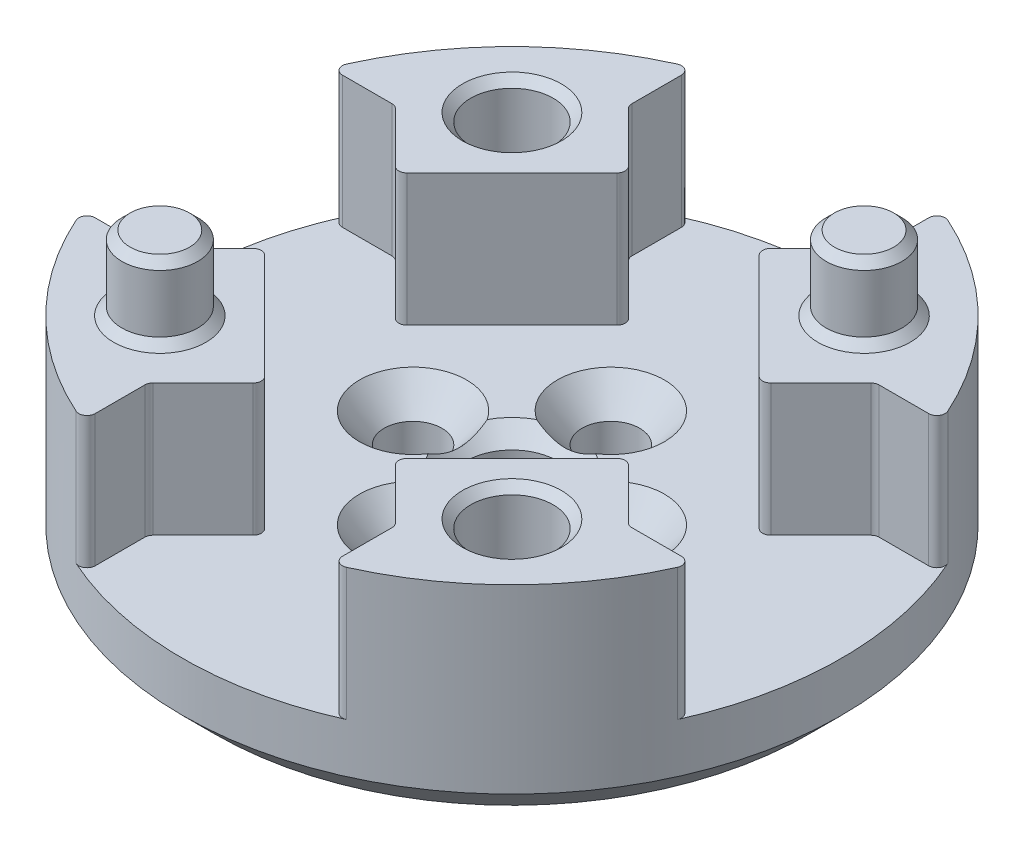
from build123d import *
from OCP.BRepFilletAPI import BRepFilletAPI_MakeChamfer

# Parameters (mm, degrees)
SKETCH_1_R                             = 20
EXTRUDE_1_DEPTH                        = 5
EXTRUDE_2_DEPTH                        = 8
FILLET_1_R                             = 0.5
PATTERN_START                          = 5
PATTERN_CIRCULAR_1_DEPTH               = 8
SKETCH_3_R                             = 2.5000000000000004
CUT_EXTRUDE_1_DEPTH                    = 5
EXTRUDE_START                          = 4.5
SKETCH_3_3_R                           = 2.5000000000000004
SKETCH_3_3_R_2                         = 2.2999999999999994
EXTRUDE_3_DEPTH                        = 4.5
CHAMFER_1_SIZE                         = 0.5
SKETCH_4_R                             = 2.75
CUT_EXTRUDE_2_DEPTH                    = 34.26033673912518
CHAMFER_2_SIZE                         = 2
CUT_EXTRUDE_3_REACH                    = 32.923
SKETCH_5_R                             = 1.75
CHAMFER_3_SIZE2                        = 1.787630389
CHAMFER_3_SIZE                         = 1.5
PATTERN_CIRCULAR_2_COUNT               = 4
CHAMFER_3_OF_PATTERN_CIRCULAR_2_SIZE   = 1.5
CHAMFER_3_OF_PATTERN_CIRCULAR_2_SIZE_2 = 1.787630389
CHAMFER_4_SIZE                         = 1


# Read off the part's stored shape, not the designer's step: 阵列(圆周)1
# Some blends are built 0.0001 mm under size
with BuildPart() as part:
    # 草图1 → 凸台-拉伸1 (new body)
    with BuildSketch(Plane(origin=(0, 0, 0), x_dir=(1, 0, 0), z_dir=(0, 1, 0))):
        with Locations(Location((0, 0, 0), (0, 0, 270))):
            Circle(SKETCH_1_R)
    extrude(amount=EXTRUDE_1_DEPTH)

    # 草图2 → 凸台-拉伸2 (add)
    with BuildSketch(Plane(origin=(0, 5, 0), x_dir=(1, 0, 0), z_dir=(0, 1, 0))):
        with BuildLine():
            Line((14.57106781186547, -7.500000000000001), (11.035533905932741, -3.9644660940672627))
            Line((11.035533905932741, -3.9644660940672627), (3.9644660940672627, -11.03553390593274))
            Line((3.9644660940672627, -11.03553390593274), (7.500000000000001, -14.571067811865477))
            Line((7.500000000000001, -14.571067811865477), (7.500000000000001, -18.540496217739157))
            ThreePointArc((7.500000000000001, -18.540496217739157), (14.142135623730951, -14.14213562373095), (18.540496217739157, -7.500000000000001))
            Line((18.540496217739157, -7.500000000000001), (14.57106781186547, -7.500000000000001))
        make_face()
    extrude(amount=EXTRUDE_2_DEPTH)

    # 圆角1
    fillet_1_edges = [part.edges().sort_by_distance(p)[0] for p in [
        (7.500000000000001, 9, 14.571067811865477),
        (7.500000000000001, 9, 18.540496217739157),
        (18.540496217739154, 9, 7.500000000000002),
        (14.57106781186547, 9, 7.500000000000001),
        (11.035533905932741, 9, 3.9644660940672627),
        (3.9644660940672627, 9, 11.03553390593274),
    ]]
    fillet(fillet_1_edges, radius=FILLET_1_R)

    # 阵列(圆周)1 outline → 阵列(圆周)1 (add)
    with BuildSketch(Plane(origin=(0, 0, 0), x_dir=(1, 0, 0), z_dir=(0, 1, 0)).offset(PATTERN_START)):
        with BuildLine():
            ThreePointArc((17.783419244, 7.5), (18.203278805, 7.728489505), (18.239404353, 8.205128205))
            ThreePointArc((18.239404353, 8.205128205), (14.142135624, 14.142135624), (8.205128205, 18.239404353))
            ThreePointArc((8.205128205, 18.239404353), (7.728489505, 18.203278805), (7.5, 17.783419244))
            Line((7.5, 17.783419244), (7.5, 14.778174593))
            ThreePointArc((7.5, 14.778174593), (7.461939766, 14.586832877), (7.353553391, 14.424621202))
            Line((7.353553391, 14.424621202), (4.318019485, 11.389087297))
            ThreePointArc((4.318019485, 11.389087297), (4.171572875, 11.035533906), (4.318019485, 10.681980515))
            Line((4.318019485, 10.681980515), (10.681980515, 4.318019485))
            ThreePointArc((10.681980515, 4.318019485), (11.035533906, 4.171572875), (11.389087297, 4.318019485))
            Line((11.389087297, 4.318019485), (14.424621202, 7.353553391))
            ThreePointArc((14.424621202, 7.353553391), (14.586832877, 7.461939766), (14.778174593, 7.5))
            Line((14.778174593, 7.5), (17.783419244, 7.5))
        make_face()
        with BuildLine():
            ThreePointArc((-18.239404353, -8.205128205), (-14.142135624, -14.142135624), (-8.205128205, -18.239404353))
            ThreePointArc((-8.205128205, -18.239404353), (-7.728489505, -18.203278805), (-7.5, -17.783419244))
            Line((-7.5, -17.783419244), (-7.5, -14.778174593))
            ThreePointArc((-7.5, -14.778174593), (-7.461939766, -14.586832877), (-7.353553391, -14.424621202))
            Line((-7.353553391, -14.424621202), (-4.318019485, -11.389087297))
            ThreePointArc((-4.318019485, -11.389087297), (-4.171572875, -11.035533906), (-4.318019485, -10.681980515))
            Line((-4.318019485, -10.681980515), (-10.681980515, -4.318019485))
            ThreePointArc((-10.681980515, -4.318019485), (-11.035533906, -4.171572875), (-11.389087297, -4.318019485))
            Line((-11.389087297, -4.318019485), (-14.424621202, -7.353553391))
            ThreePointArc((-14.424621202, -7.353553391), (-14.586832877, -7.461939766), (-14.778174593, -7.5))
            Line((-14.778174593, -7.5), (-17.783419244, -7.5))
            ThreePointArc((-17.783419244, -7.5), (-18.203278805, -7.728489505), (-18.239404353, -8.205128205))
        make_face()
        with BuildLine():
            ThreePointArc((-7.5, 17.783419244), (-7.728489505, 18.203278805), (-8.205128205, 18.239404353))
            ThreePointArc((-8.205128205, 18.239404353), (-14.142135624, 14.142135624), (-18.239404353, 8.205128205))
            ThreePointArc((-18.239404353, 8.205128205), (-18.203278805, 7.728489505), (-17.783419244, 7.5))
            Line((-17.783419244, 7.5), (-14.778174593, 7.5))
            ThreePointArc((-14.778174593, 7.5), (-14.586832877, 7.461939766), (-14.424621202, 7.353553391))
            Line((-14.424621202, 7.353553391), (-11.389087297, 4.318019485))
            ThreePointArc((-11.389087297, 4.318019485), (-11.035533906, 4.171572875), (-10.681980515, 4.318019485))
            Line((-10.681980515, 4.318019485), (-4.318019485, 10.681980515))
            ThreePointArc((-4.318019485, 10.681980515), (-4.171572875, 11.035533906), (-4.318019485, 11.389087297))
            Line((-4.318019485, 11.389087297), (-7.353553391, 14.424621202))
            ThreePointArc((-7.353553391, 14.424621202), (-7.461939766, 14.586832877), (-7.5, 14.778174593))
            Line((-7.5, 14.778174593), (-7.5, 17.783419244))
        make_face()
    extrude(amount=PATTERN_CIRCULAR_1_DEPTH)

    # 草图3 → 切除-拉伸1 (cut)
    with BuildSketch(Plane(origin=(0, 13.000000000000002, 0), x_dir=(1, 0, 0), z_dir=(0, 1, 0))):
        with Locations(Location((-10.681980515339466, 10.681980515339463, 0), (0, 0, 270))):
            Circle(SKETCH_3_R)
        with Locations(Location((10.681980515339466, -10.681980515339463, 0), (0, 0, 270))):
            Circle(SKETCH_3_R)
    extrude(amount=-CUT_EXTRUDE_1_DEPTH, mode=Mode.SUBTRACT)

    # 草图3<3> → 凸台-拉伸3 (add)
    with BuildSketch(Plane(origin=(0, 13.000000000000002, 0), x_dir=(1, 0, 0), z_dir=(0, 1, 0)).offset(EXTRUDE_START)):
        with Locations(Location((10.681980515339466, -10.681980515339463, 0), (0, 0, 270))):
            Circle(SKETCH_3_3_R)
        with Locations(Location((-10.681980515339466, 10.681980515339463, 0), (0, 0, 270))):
            Circle(SKETCH_3_3_R)
        with Locations(Location((10.681980515339466, 10.681980515339463, 0), (0, 0, 270))):
            Circle(SKETCH_3_3_R_2)
        with Locations(Location((-10.681980515339465, -10.681980515339465, 0), (0, 0, 270))):
            Circle(SKETCH_3_3_R_2)
    extrude(amount=-EXTRUDE_3_DEPTH)


with BuildPart() as extrude_3_kept_piece:
    # of the separate pieces the step leaves, the one the design keeps (extrude_3_pieces_kept)
    add(part.part.solids().sort_by_distance((8.205128205, 5, 18.239404353))[0])

    # 倒角1
    chamfer_1_edges = [extrude_3_kept_piece.edges().sort_by_distance(p)[0] for p in [
        (-10.681980515339466, 8.000000000000002, -13.181980515339463),
        (-10.681980515339466, 13.000000000000002, -13.181980515339463),
        (10.681980515339466, 8.000000000000002, 8.181980515339463),
        (10.681980515339466, 13.000000000000002, 8.181980515339463),
        (10.681980515339466, 13.000000000000002, -12.981980515339462),
        (10.681980515339466, 17.5, -12.981980515339462),
        (-10.681980515339465, 13.000000000000002, 8.381980515339466),
        (-10.681980515339465, 17.5, 8.381980515339466),
    ]]
    chamfer(chamfer_1_edges, length=CHAMFER_1_SIZE)

    # 草图4 → 切除-拉伸2 (cut, through all)
    with BuildSketch(Plane.XZ):
        with Locations(Location((0, 0, 0), (0, 0, 270))):
            Circle(SKETCH_4_R)
    extrude(amount=-CUT_EXTRUDE_2_DEPTH, mode=Mode.SUBTRACT)

    # 倒角2
    chamfer_2_edges = [extrude_3_kept_piece.edges().sort_by_distance(p)[0] for p in [
        (6.12e-15, 0, -20),
    ]]
    chamfer(chamfer_2_edges, length=CHAMFER_2_SIZE)

    # 草图5 → 切除-拉伸3 (cut, up to next)
    with BuildSketch(Plane(origin=(0, 5, 0), x_dir=(1, 0, 0), z_dir=(0, 1, 0)), mode=Mode.PRIVATE) as cut_extrude_3_sk1:
        with Locations(Location((6, 0, 0), (0, 0, 270))):
            Circle(SKETCH_5_R)
    cut_extrude_3_tool1 = extrude(cut_extrude_3_sk1.sketch, amount=-CUT_EXTRUDE_3_REACH, mode=Mode.PRIVATE) & extrude_3_kept_piece.part
    cut_extrude_3 = cut_extrude_3_tool1.solids().sort_by_distance((6, 5, 0))[0]
    add(cut_extrude_3, mode=Mode.SUBTRACT)

    # 倒角3
    chamfer_3_edges = [extrude_3_kept_piece.edges().sort_by_distance(p)[0] for p in [
        (6.000000000000001, 5, -1.75),
    ]]
    chamfer_3_side = [extrude_3_kept_piece.faces().sort_by_distance(p)[0] for p in [
        (6.000000000000001, 5, -1.78),
    ]]
    chamfer(chamfer_3_edges, length=CHAMFER_3_SIZE - 0.0001, length2=CHAMFER_3_SIZE2 - 0.0001, reference=chamfer_3_side[0])  # a hair under: the kernel refuses the full size

    # 阵列(圆周)2: 切除-拉伸3 ×4 about axis
    pattern_circular_2_axis = Axis((0, 0, -1.047e-14), (0, 1, 0))
    for i in range(1, PATTERN_CIRCULAR_2_COUNT):
        add(cut_extrude_3.rotate(pattern_circular_2_axis, i * 360 / PATTERN_CIRCULAR_2_COUNT), mode=Mode.SUBTRACT)

    # 倒角3 of 阵列(圆周)2
    chamfer_3_of_pattern_circular_2_edges_1 = [extrude_3_kept_piece.edges().sort_by_distance(p)[0] for p in [
        (-1.749999999999989, 5, -6.0000000000000115),
    ]]
    chamfer_3_of_pattern_circular_2_side_1 = [extrude_3_kept_piece.faces().sort_by_distance(p)[0] for p in [
        (-1.779999999999989, 5, -6.0000000000000115),
    ]]
    chamfer_3_of_pattern_circular_2_edges_2 = [extrude_3_kept_piece.edges().sort_by_distance(p)[0] for p in [
        (-6.000000000000001, 5, 1.7499999999999785),
    ]]
    chamfer_3_of_pattern_circular_2_side_2 = [extrude_3_kept_piece.faces().sort_by_distance(p)[0] for p in [
        (-6.000000000000001, 5, 1.7799999999999785),
    ]]
    chamfer_3_of_pattern_circular_2_edges_3 = [extrude_3_kept_piece.edges().sort_by_distance(p)[0] for p in [
        (1.7499999999999882, 5, 5.99999999999999),
    ]]
    chamfer_3_of_pattern_circular_2_side_3 = [extrude_3_kept_piece.faces().sort_by_distance(p)[0] for p in [
        (1.7799999999999883, 5, 5.99999999999999),
    ]]
    chamfer_3_of_pattern_circular_2 = BRepFilletAPI_MakeChamfer(extrude_3_kept_piece.part.solid().wrapped)
    for e in chamfer_3_of_pattern_circular_2_edges_1:
        chamfer_3_of_pattern_circular_2.Add(CHAMFER_3_OF_PATTERN_CIRCULAR_2_SIZE - 0.0001, CHAMFER_3_OF_PATTERN_CIRCULAR_2_SIZE_2 - 0.0001, e.wrapped, chamfer_3_of_pattern_circular_2_side_1[0].wrapped)
    for e in chamfer_3_of_pattern_circular_2_edges_2:
        chamfer_3_of_pattern_circular_2.Add(CHAMFER_3_OF_PATTERN_CIRCULAR_2_SIZE - 0.0001, CHAMFER_3_OF_PATTERN_CIRCULAR_2_SIZE_2 - 0.0001, e.wrapped, chamfer_3_of_pattern_circular_2_side_2[0].wrapped)
    for e in chamfer_3_of_pattern_circular_2_edges_3:
        chamfer_3_of_pattern_circular_2.Add(CHAMFER_3_OF_PATTERN_CIRCULAR_2_SIZE - 0.0001, CHAMFER_3_OF_PATTERN_CIRCULAR_2_SIZE_2 - 0.0001, e.wrapped, chamfer_3_of_pattern_circular_2_side_3[0].wrapped)
    add(Compound.cast(chamfer_3_of_pattern_circular_2.Shape()), mode=Mode.REPLACE)  # a hair under: the kernel refuses the full size

    # 倒角4
    # the kernel refuses this chamfer: 1 mm, written as the material it takes off along each edge
    with BuildSketch(Plane(origin=(0, 5, 0), x_dir=(-1.8e-16, 0, -1), z_dir=(-1, 0, 1.8e-16))) as chamfer_4_piece_1:
        Polygon((2.75 + CHAMFER_4_SIZE, 0), (2.75, CHAMFER_4_SIZE), (2.75, 0), align=None)
    revolve(axis=Axis((0, 5, 0), (0, -1, 0)), mode=Mode.SUBTRACT)


solid = extrude_3_kept_piece.part
